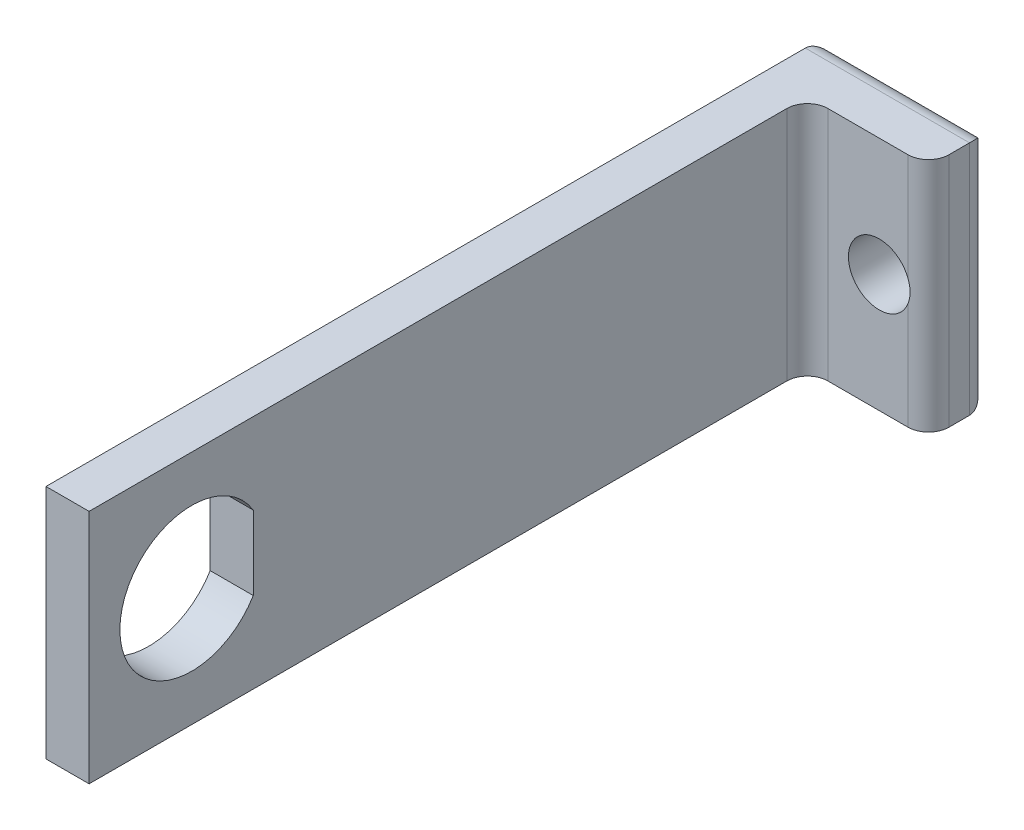
from build123d import *

# Parameters (mm, degrees)
BOSS_EXTRUDE2_DEPTH = 11.5
CUT_EXTRUDE1_REACH  = 46.232
SKETCH4_R           = 1.5
CUT_EXTRUDE2_REACH  = 39.699
FILLET2_R           = 1


with BuildPart() as part:
    # Sketch3 → Boss-Extrude2 (new body)
    with BuildSketch(Plane(origin=(0, 0, 0), x_dir=(1, 0, 0), z_dir=(0, 1, 0))):
        Polygon((-19.5, 3), (-11.5, 3), (-11.5, 0), (-17.4, 0), (-17.4, -35), (-19.5, -35), align=None)
    extrude(amount=BOSS_EXTRUDE2_DEPTH)

    # Sketch4 → Cut-Extrude1 (cut, up to next)
    with BuildSketch(Plane(origin=(0, 0, -3), x_dir=(-1, 0, 0), z_dir=(0, 0, -1)), mode=Mode.PRIVATE) as cut_extrude1_sk1:
        with Locations((13.9, 5.75)):
            Circle(SKETCH4_R)
    cut_extrude1_tool1 = extrude(cut_extrude1_sk1.sketch, amount=-CUT_EXTRUDE1_REACH, mode=Mode.PRIVATE) & part.part
    add(cut_extrude1_tool1.solids().sort_by_distance((-13.9, 5.75, -3))[0], mode=Mode.SUBTRACT)

    # Sketch5 → Cut-Extrude2 (cut, up to next)
    with BuildSketch(Plane.ZY.offset(19.5), mode=Mode.PRIVATE) as cut_extrude2_sk1:
        with BuildLine():
            Line((27, 3.947224362), (27, 7.552775638))
            ThreePointArc((27, 7.552775638), (33.5, 5.75), (27, 3.947224362))
        make_face()
    cut_extrude2_tool1 = extrude(cut_extrude2_sk1.sketch, amount=-CUT_EXTRUDE2_REACH, mode=Mode.PRIVATE) & part.part
    add(cut_extrude2_tool1.solids().sort_by_distance((-19.5, 5.75, 30.104819))[0], mode=Mode.SUBTRACT)

    # Fillet2
    # the kernel refuses this fillet: 1 mm, written as the material it adds along each edge
    with BuildSketch(Plane(origin=(-17.4, 0, 0), x_dir=(1, 0, 0), z_dir=(0, 1, 0))) as fillet2_piece_1:
        with BuildLine():
            CenterArc((FILLET2_R, -FILLET2_R), FILLET2_R, 90, 90)
            Line((0, -FILLET2_R), (0, 0))
            Line((0, 0), (FILLET2_R, 0))
        make_face()
    extrude(amount=11.5)
    # the kernel refuses this fillet: 1 mm, written as the material it takes off along each edge
    with BuildSketch(Plane(origin=(-19.5, -2.5, -3), x_dir=(1, 0, 0), z_dir=(0, 1, 0))) as fillet2_2_piece_1:
        with BuildLine():
            CenterArc((FILLET2_R, -FILLET2_R), FILLET2_R, 90, 90)
            Line((0, -FILLET2_R), (0, 0))
            Line((0, 0), (FILLET2_R, 0))
        make_face()
    extrude(amount=16.5, mode=Mode.SUBTRACT)
    with BuildSketch(Plane(origin=(-11.5, -2.5, -3), x_dir=(-1, 0, 0), z_dir=(0, 1, 0)), Plane(origin=(-11.5, -2.5, 0), x_dir=(0, 0, -1), z_dir=(0, 1, 0))) as fillet2_2_piece_2:
        with BuildLine():
            CenterArc((FILLET2_R, FILLET2_R), FILLET2_R, 180, 90)
            Line((0, FILLET2_R), (0, 0))
            Line((0, 0), (FILLET2_R, 0))
        make_face()
    extrude(amount=16.5, mode=Mode.SUBTRACT)
    with BuildSketch(Plane(origin=(-22, 11.5, -3), x_dir=(0, -1, 0), z_dir=(1, 0, 0))) as fillet2_2_piece_3:
        with BuildLine():
            CenterArc((FILLET2_R, -FILLET2_R), FILLET2_R, 90, 90)
            Line((0, -FILLET2_R), (0, 0))
            Line((0, 0), (FILLET2_R, 0))
        make_face()
    extrude(amount=13, mode=Mode.SUBTRACT)
    with BuildSketch(Plane(origin=(-22, 0, -3), x_dir=(0, 1, 0), z_dir=(1, 0, 0))) as fillet2_2_piece_4:
        with BuildLine():
            CenterArc((FILLET2_R, FILLET2_R), FILLET2_R, 180, 90)
            Line((0, FILLET2_R), (0, 0))
            Line((0, 0), (FILLET2_R, 0))
        make_face()
    extrude(amount=13, mode=Mode.SUBTRACT)


solid = part.part
